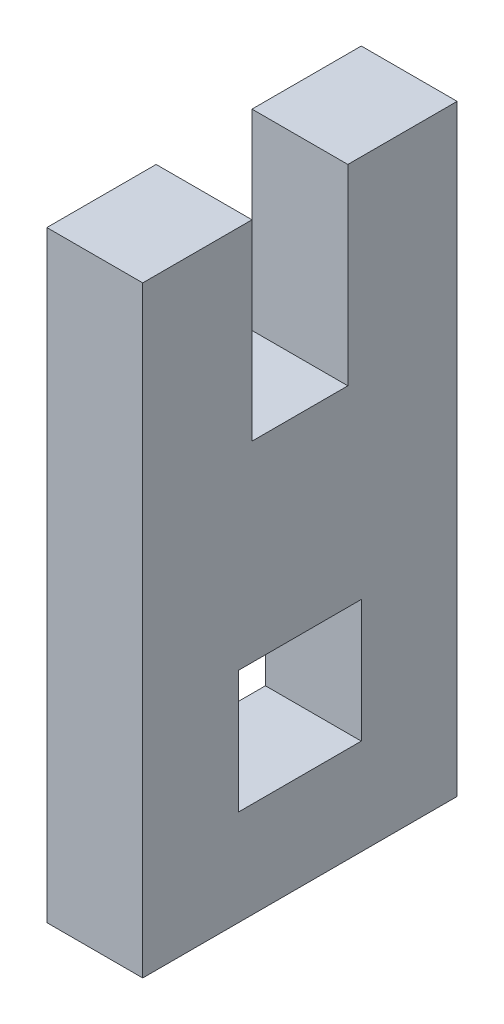
from build123d import *

# Parameters (mm, degrees)
SKETCH2_W           = 8.128
SKETCH2_H           = 8.128
BOSS_EXTRUDE1_DEPTH = 6.35


with BuildPart() as part:
    # Sketch2 → Boss-Extrude1 (new body)
    with BuildSketch(Plane(origin=(0, 0, 0), x_dir=(0, 0, -1), z_dir=(1, 0, 0))):
        Polygon((0, 0), (0, 39.878), (7.239, 39.878), (7.239, 27.178), (13.589, 27.178), (13.589, 39.878), (20.828, 39.878), (20.828, 0), align=None)
        with Locations((10.414, 10.414)):
            Rectangle(SKETCH2_W, SKETCH2_H, mode=Mode.SUBTRACT)
    extrude(amount=BOSS_EXTRUDE1_DEPTH)


solid = part.part
